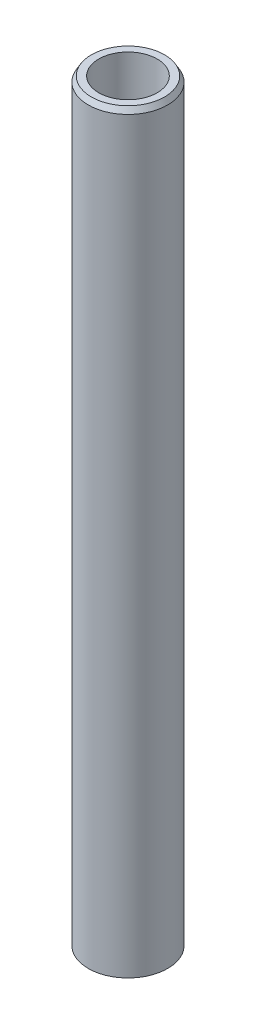
from build123d import *
from OCP.BRepFilletAPI import BRepFilletAPI_MakeChamfer

# Parameters (mm, degrees)
SKETCH1_R           = 30
BOSS_EXTRUDE1_DEPTH = 571.675702433
SKETCH2_R           = 22.123032826
CUT_EXTRUDE1_DEPTH  = 574.247859789
CHAMFER1_SIZE       = 4.057454055
CHAMFER1_SIZE2      = 2.342572191


with BuildPart() as part:
    # Sketch1 → Boss-Extrude1 (new body)
    with BuildSketch(Plane(origin=(0, 0, 0), x_dir=(1, 0, 0), z_dir=(0, 1, 0))):
        Circle(SKETCH1_R)
    extrude(amount=BOSS_EXTRUDE1_DEPTH)

    # Sketch2 → Cut-Extrude1 (cut, through all)
    with BuildSketch(Plane(origin=(0, 0, 0), x_dir=(1, 0, 0), z_dir=(0, 1, 0))):
        Circle(SKETCH2_R)
    extrude(amount=CUT_EXTRUDE1_DEPTH, mode=Mode.SUBTRACT)

    # Chamfer1: one chamfer whose edges measure the first distance from different faces: ONE call of the kernel's chamfer builder (chamfer() names one face for all edges)
    chamfer1_edges_1 = [part.edges().sort_by_distance(p)[0] for p in [
        (-30, 571.675702433, 0),
    ]]
    chamfer1_side_1 = [part.faces().sort_by_distance(p)[0] for p in [
        (-30, 285.837851217, 0),
    ]]
    chamfer1_edges_2 = [part.edges().sort_by_distance(p)[0] for p in [
        (-30, 0, 0),
    ]]
    chamfer1_side_2 = [part.faces().sort_by_distance(p)[0] for p in [
        (-29.151471863, 0, 0),
    ]]
    chamfer1 = BRepFilletAPI_MakeChamfer(part.part.solid().wrapped)
    for e in chamfer1_edges_1:
        chamfer1.Add(CHAMFER1_SIZE, CHAMFER1_SIZE2, e.wrapped, chamfer1_side_1[0].wrapped)  # the first distance lies on this face
    for e in chamfer1_edges_2:
        chamfer1.Add(CHAMFER1_SIZE, CHAMFER1_SIZE2, e.wrapped, chamfer1_side_2[0].wrapped)  # the first distance lies on this face
    add(Compound.cast(chamfer1.Shape()), mode=Mode.REPLACE)


solid = part.part
